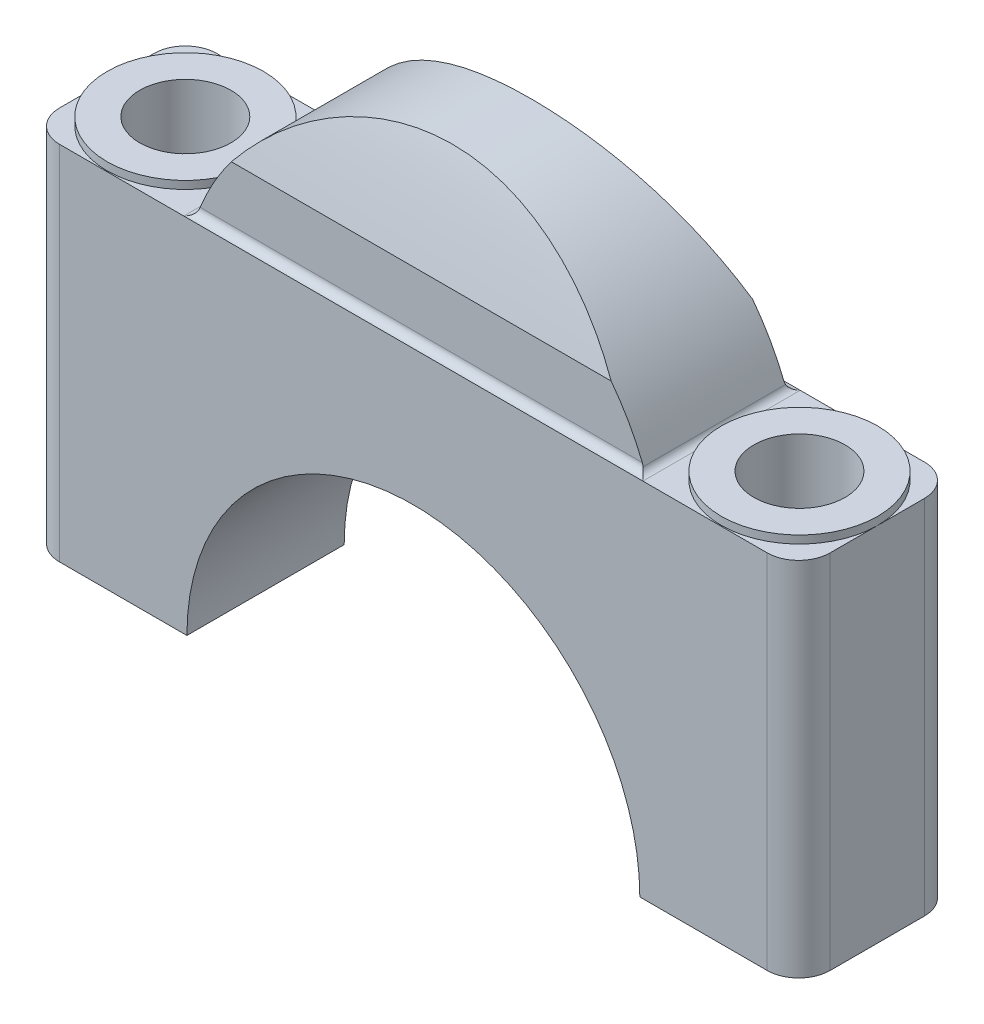
from build123d import *

# Parameters (mm, degrees)
SALIENTE_EXTRUIR2_DEPTH    = 10
CROQUIS3_R                 = 9.947805623
SALIENTE_EXTRUIR3_DEPTH    = 1
CORTAR_EXTRUIR1_DEPTH      = 68.948509917
CORTAR_EXTRUIR1_DEPTH_BACK = 68.948509917
CROQUIS4_R                 = 5.8
SALIENTE_EXTRUIR4_DEPTH    = 9
CORTAR_EXTRUIR2_DEPTH      = 83.807004535
CORTAR_EXTRUIR2_DEPTH_BACK = 83.807004535
REDONDEO3_START            = -10.0000001
REDONDEO3_DEPTH            = 1.0000001
REDONDEO3_START_2          = 9
REDONDEO3_2_DEPTH          = 1
REDONDEO3_START_3          = -9
REDONDEO3_3_DEPTH          = 18
REDONDEO3_START_4          = -29.193321254
REDONDEO3_4_DEPTH          = 58.386642508
REDONDEO4_R                = 4


with BuildPart() as part:
    # Croquis2 → Saliente-Extruir2 (new, symmetric)
    with BuildSketch(Plane.XY):
        with BuildLine():
            Line((-49, 0), (-49, 46))
            Line((-49, 46), (49, 46))
            Line((49, 46), (49, 0))
            Line((49, 0), (28.8, 0))
            ThreePointArc((28.8, 0), (0, 28.8), (-28.8, 0))
            Line((-28.8, 0), (-49, 0))
        make_face()
    extrude(amount=SALIENTE_EXTRUIR2_DEPTH, both=True)

    # Croquis3 → Saliente-Extruir3 (add)
    with BuildSketch(Plane(origin=(0, 46, 0), x_dir=(1, 0, 0), z_dir=(0, 1, 0))):
        with Locations(Location((-39.052194377, 0.052194377, 0), (0, 0, 90))):
            Circle(CROQUIS3_R)
        with Locations(Location((39.052194377, 0.052194377, 0), (0, 0, 90))):
            Circle(CROQUIS3_R)
    extrude(amount=SALIENTE_EXTRUIR3_DEPTH)

    # Croquis4 → Cortar-Extruir1 (cut, two sides: drawn at the far end of the back side and taken through both)
    with BuildSketch(Plane(origin=(0, 46, 0), x_dir=(1, 0, 0), z_dir=(0, 1, 0)).offset(-CORTAR_EXTRUIR1_DEPTH_BACK)):
        with Locations(Location((-39.052194377, 0.052194377, 0), (0, 0, 270))):
            Circle(CROQUIS4_R)
        with Locations(Location((39.052194377, 0.052194377, 0), (0, 0, 270))):
            Circle(CROQUIS4_R)
    extrude(amount=CORTAR_EXTRUIR1_DEPTH + CORTAR_EXTRUIR1_DEPTH_BACK, mode=Mode.SUBTRACT)

    # Croquis5 → Saliente-Extruir4 (add, symmetric)
    with BuildSketch(Plane.XY):
        with BuildLine():
            Line((-28.5, 46), (28.5, 46))
            ThreePointArc((28.5, 46), (0, 66), (-28.5, 46))
        make_face()
    extrude(amount=SALIENTE_EXTRUIR4_DEPTH, both=True)

    # Croquis6 → Cortar-Extruir2 (cut, two sides: drawn at the far end of the back side and taken through both)
    with BuildSketch(Plane(origin=(0, 0, 0), x_dir=(0, 0, -1), z_dir=(1, 0, 0)).offset(-CORTAR_EXTRUIR2_DEPTH_BACK)):
        with BuildLine():
            Line((-9, 66), (-9, 54))
            add(Edge.make_bspline(
                [(-9, 54), (-6.728088744, 61.714285714), (-5, 66)],
                knots=[0, 0, 0, 0.174230423, 0.174230423, 0.174230423], degree=2, weights=[1, 1.104611797, 1.172770478]))
            Line((-5, 66), (-9, 66))
        make_face()
        with BuildLine():
            add(Edge.make_bspline(
                [(5, 66), (6.728088744, 61.714285714), (9, 54)],
                knots=[0.825769577, 0.825769577, 0.825769577, 1, 1, 1], degree=2, weights=[1.172770478, 1.104611797, 1]))
            Line((9, 54), (9, 66))
            Line((9, 66), (5, 66))
        make_face()
    extrude(amount=CORTAR_EXTRUIR2_DEPTH + CORTAR_EXTRUIR2_DEPTH_BACK, mode=Mode.SUBTRACT)

    # Redondeo3: read off the stored shape, not the designer's step
    # Redondeo3 outline → Redondeo3 (add)
    with BuildSketch(Plane.XY.offset(REDONDEO3_START)):
        with BuildLine():
            Line((-29.193321154, 46), (29.193321154, 46))
            ThreePointArc((29.193321154, 46), (28.62814416, 46.175030325), (28.260813391, 46.63885007))
            ThreePointArc((28.260813391, 46.63885007), (0, 66), (-28.260813391, 46.63885007))
            ThreePointArc((-28.260813391, 46.63885007), (-28.62814416, 46.175030325), (-29.193321154, 46))
        make_face()
    extrude(amount=REDONDEO3_DEPTH)

    # Redondeo3 2 outline → Redondeo3 2 (add)
    with BuildSketch(Plane.XY.offset(REDONDEO3_START_2)):
        with BuildLine():
            Line((-29.193321154, 46), (29.193321154, 46))
            ThreePointArc((29.193321154, 46), (28.62814416, 46.175030325), (28.260813391, 46.63885007))
            ThreePointArc((28.260813391, 46.63885007), (0, 66), (-28.260813391, 46.63885007))
            ThreePointArc((-28.260813391, 46.63885007), (-28.62814416, 46.175030325), (-29.193321154, 46))
        make_face()
    extrude(amount=REDONDEO3_2_DEPTH)

    # Redondeo3 3 outline → Redondeo3 3 (add)
    with BuildSketch(Plane.XY.offset(REDONDEO3_START_3)):
        with BuildLine():
            ThreePointArc((-28.5, 46), (-28.382204223, 46.320098033), (-28.260813391, 46.63885007))
            ThreePointArc((-28.260813391, 46.63885007), (-28.62814416, 46.175030325), (-29.193321154, 46))
            Line((-29.193321154, 46), (-28.5, 46))
        make_face()
        with BuildLine():
            ThreePointArc((29.193321154, 46), (28.62814416, 46.175030325), (28.260813391, 46.63885007))
            ThreePointArc((28.260813391, 46.63885007), (28.382204223, 46.320098033), (28.5, 46))
            Line((28.5, 46), (29.193321154, 46))
        make_face()
    extrude(amount=REDONDEO3_3_DEPTH)

    # Redondeo3 4 outline → Redondeo3 4 (cut)
    with BuildSketch(Plane.YZ.offset(REDONDEO3_START_4)):
        with BuildLine():
            Line((47, 9), (67, 9))
            Line((67, 9), (67, 10))
            Line((67, 10), (46, 10))
            ThreePointArc((46, 10), (46.292893219, 9.292893219), (47, 9))
        make_face()
        with BuildLine():
            Line((67, -10), (67, -9))
            Line((67, -9), (47, -9))
            ThreePointArc((47, -9), (46.292893219, -9.292893219), (46, -10))
            Line((46, -10), (67, -10))
        make_face()
    extrude(amount=REDONDEO3_4_DEPTH, mode=Mode.SUBTRACT)

    # Redondeo4
    redondeo4_edges = [part.edges().sort_by_distance(p)[0] for p in [
        (49, 23, 10),
        (-49, 23, 10),
        (-49, 23, -10),
        (49, 23, -10),
    ]]
    fillet(redondeo4_edges, radius=REDONDEO4_R)


solid = part.part
